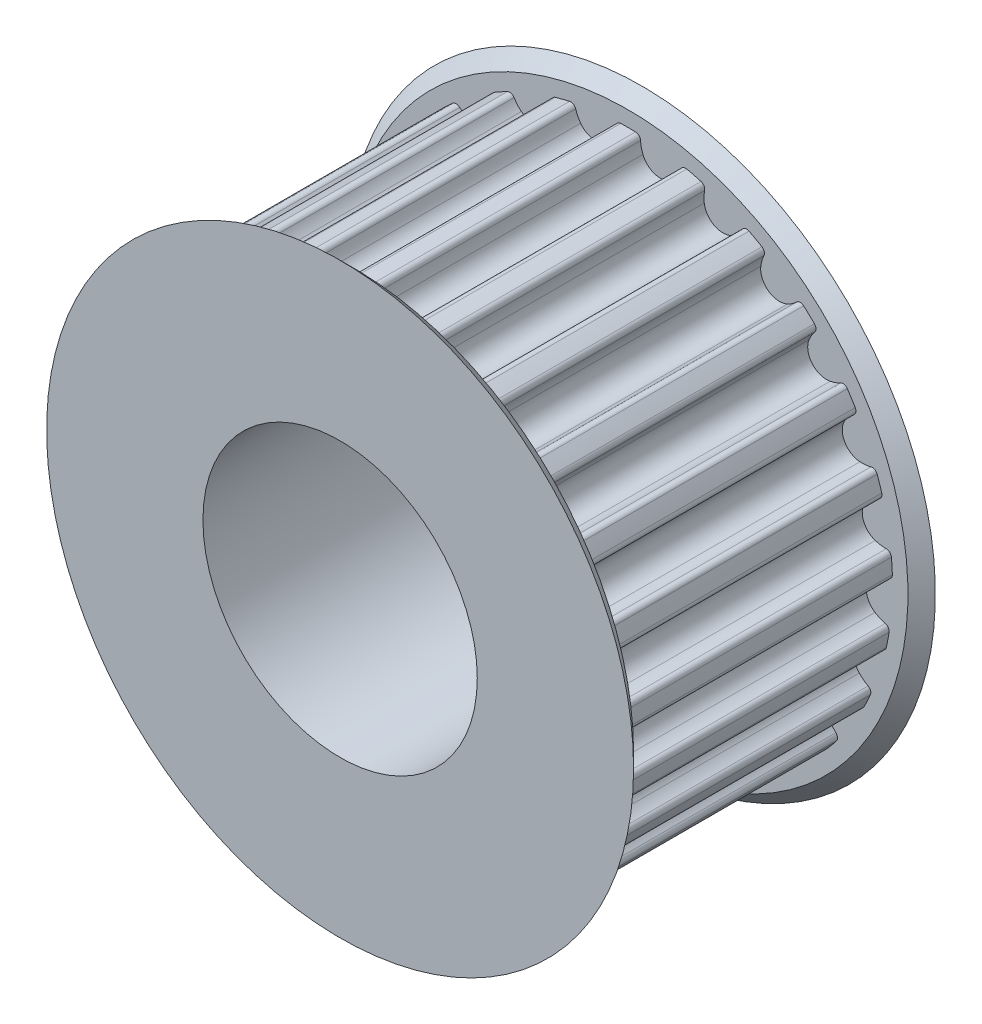
from build123d import *

# Parameters (mm, degrees)
SKETCH1_R           = 7.957747155
BOSS_EXTRUDE1_DEPTH = 4
CUT_EXTRUDE1_DEPTH  = 8
CIRPATTERN1_COUNT   = 25
SKETCH4_R           = 8.557747155
BOSS_EXTRUDE2_DEPTH = 0.4
CHAMFER1_SIZE       = 0.4
SKETCH5_R           = 4
CUT_EXTRUDE2_DEPTH  = 15.963624986


with BuildPart() as part:
    # Sketch1 → Boss-Extrude1 (new, symmetric)
    with BuildSketch(Plane.XY):
        Circle(SKETCH1_R)
    extrude(amount=BOSS_EXTRUDE1_DEPTH, both=True)

    # Sketch3 → Cut-Extrude1 (cut)
    with BuildSketch(Plane.XY.offset(4)):
        with BuildLine():
            Line((0, 7.957747155), (0, 7.707747155))
            ThreePointArc((0, 7.707747155), (0.107531497, 7.706997027), (0.215042063, 7.704746791))
            ThreePointArc((0.215042063, 7.704746791), (0.315648684, 7.66213054), (0.360656001, 7.562570616))
            ThreePointArc((0.360656001, 7.562570616), (0.382244165, 7.401425952), (0.429659879, 7.24590939))
            ThreePointArc((0.429659879, 7.24590939), (0.872036949, 6.90288324), (1.385823064, 7.125117889))
            ThreePointArc((1.385823064, 7.125117889), (1.470424524, 7.263956804), (1.531409503, 7.414670053))
            ThreePointArc((1.531409503, 7.414670053), (1.599762379, 7.499909255), (1.707806489, 7.516166789))
            ThreePointArc((1.707806489, 7.516166789), (1.812499024, 7.491609539), (1.91683877, 7.465594104))
            Line((1.91683877, 7.465594104), (1.979011242, 7.707739894))
            ThreePointArc((1.979011242, 7.707739894), (0.997370183, 7.894997941), (0, 7.957747155))
        make_face()
    cut_extrude1 = extrude(amount=-CUT_EXTRUDE1_DEPTH, mode=Mode.SUBTRACT)

    # CirPattern1: Cut-Extrude1 ×25 about axis
    cirpattern1_axis = Axis((0, 0, 0), (0, 0, 1))
    for i in range(1, CIRPATTERN1_COUNT):
        add(cut_extrude1.rotate(cirpattern1_axis, i * 360 / CIRPATTERN1_COUNT), mode=Mode.SUBTRACT)

    # Sketch4 → Boss-Extrude2 (add)
    with BuildSketch(Plane.XY.offset(4)):
        Circle(SKETCH4_R)
    boss_extrude2 = extrude(amount=BOSS_EXTRUDE2_DEPTH)

    # Mirror1: Boss-Extrude2 across plane
    add(boss_extrude2.mirror(Plane.XY))

    # Chamfer1
    chamfer1_edges = [part.edges().sort_by_distance(p)[0] for p in [
        (-8.557747155, 0, 4),
        (-8.557747155, 0, -4),
    ]]
    chamfer(chamfer1_edges, length=CHAMFER1_SIZE - 0.0001)  # a hair under: the kernel refuses the full size

    # Sketch5 → Cut-Extrude2 (cut, through all)
    with BuildSketch(Plane.XY.offset(4.4)):
        Circle(SKETCH5_R)
    extrude(amount=-CUT_EXTRUDE2_DEPTH, mode=Mode.SUBTRACT)


solid = part.part
